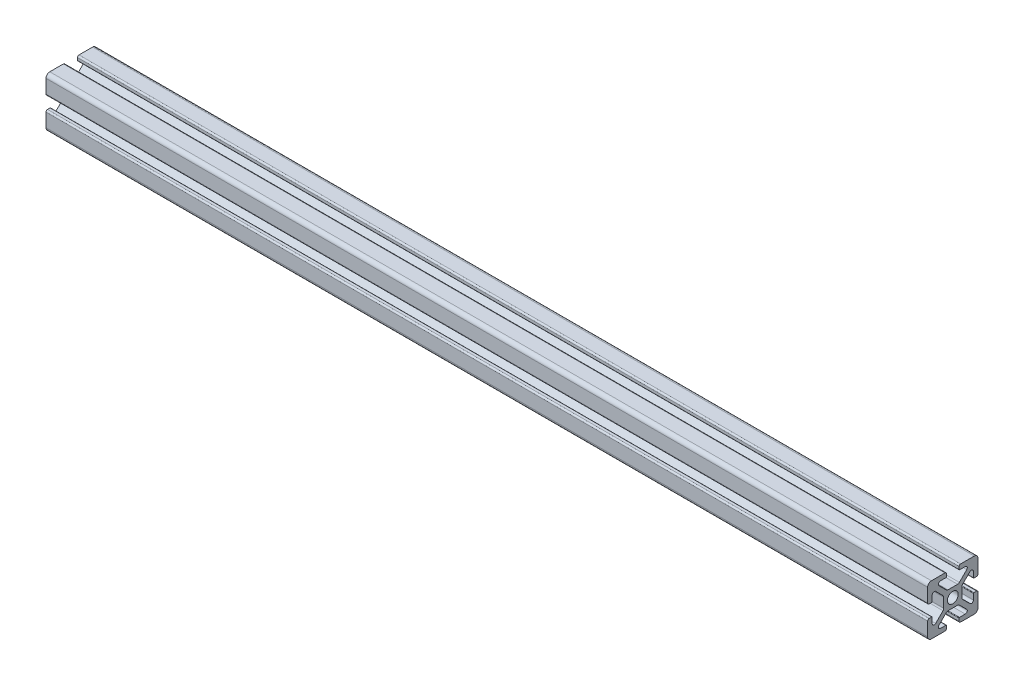
from build123d import *

# Parameters (mm, degrees)
BOSS_EXTRUDE1_DEPTH      = 175
BOSS_EXTRUDE1_DEPTH_BACK = 175


with BuildPart() as part:
    # Sketch3 → Boss-Extrude1 (new, two sides: drawn at the far end of the back side and taken through both)
    with BuildSketch(Plane(origin=(0, 0, 0), x_dir=(0, 0, -1), z_dir=(1, 0, 0)).offset(-BOSS_EXTRUDE1_DEPTH_BACK)):
        with BuildLine():
            Line((-5.515685425, 6.807463915), (-2.601114729, 3.892893219))
            ThreePointArc((-2.601114729, 3.892893219), (-2.27669138, 3.676120467), (-1.894007948, 3.6))
            Line((-1.894007948, 3.6), (0, 3.6))
            Line((0, 3.6), (0, 2.15))
            ThreePointArc((0, 2.15), (-1.52027958, 1.52027958), (-2.15, 0))
            Line((-2.15, 0), (-3.6, 0))
            Line((-3.6, 0), (-3.6, 1.894007948))
            ThreePointArc((-3.6, 1.894007948), (-3.676120467, 2.27669138), (-3.892893219, 2.601114729))
            Line((-3.892893219, 2.601114729), (-6.807463915, 5.515685425))
            ThreePointArc((-6.807463915, 5.515685425), (-7.679296086, 5.689103626), (-8.17314934, 4.95))
            Line((-8.17314934, 4.95), (-8.17314934, 2.7))
            ThreePointArc((-8.17314934, 2.7), (-8.231727984, 2.558578644), (-8.37314934, 2.5))
            Line((-8.37314934, 2.5), (-9.4, 2.5))
            ThreePointArc((-9.4, 2.5), (-9.824264069, 2.675735931), (-10, 3.1))
            Line((-10, 3.1), (-10, 8.5))
            ThreePointArc((-10, 8.5), (-9.560660172, 9.560660172), (-8.5, 10))
            Line((-8.5, 10), (-3.1, 10))
            ThreePointArc((-3.1, 10), (-2.675735931, 9.824264069), (-2.5, 9.4))
            Line((-2.5, 9.4), (-2.5, 8.37314934))
            ThreePointArc((-2.5, 8.37314934), (-2.558578644, 8.231727984), (-2.7, 8.17314934))
            Line((-2.7, 8.17314934), (-4.95, 8.17314934))
            ThreePointArc((-4.95, 8.17314934), (-5.689103626, 7.679296086), (-5.515685425, 6.807463915))
        make_face()
    extrude(amount=BOSS_EXTRUDE1_DEPTH + BOSS_EXTRUDE1_DEPTH_BACK)

    # Mirror1: part across plane


with BuildPart() as part_1:
    add(part.part)
    add(part.part.mirror(Plane.ZX))

    # Mirror2: part across plane


with BuildPart() as part_2:
    add(part_1.part)
    add(part_1.part.mirror(Plane.XY))


solid = part_2.part
